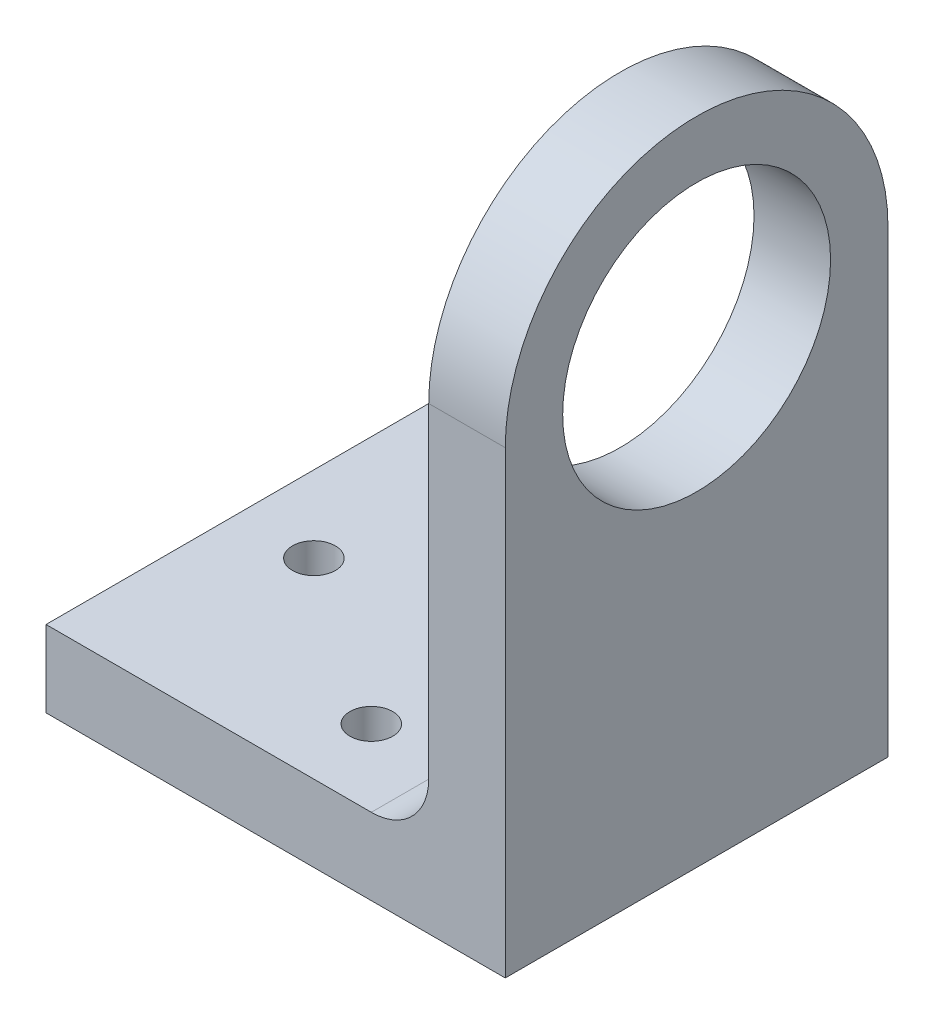
from build123d import *

# Parameters (mm, degrees)
SKETCH3_R           = 11.1125
BOSS_EXTRUDE1_DEPTH = 6.35
SKETCH5_W           = 31.75
SKETCH5_H           = 6.35
BOSS_EXTRUDE2_DEPTH = 38.1
FILLET1_R           = 4.7625
SKETCH6_R           = 1.777000002
CUT_EXTRUDE1_DEPTH  = 66.454301807


with BuildPart() as part:
    # Sketch3 → Boss-Extrude1 (new body)
    with BuildSketch(Plane(origin=(0, 0, 0), x_dir=(0, 0, -1), z_dir=(1, 0, 0))):
        with BuildLine():
            Line((0, 0), (31.75, 0))
            Line((31.75, 0), (31.75, 31.75))
            ThreePointArc((31.75, 31.75), (15.875, 47.625), (0, 31.75))
            Line((0, 31.75), (0, 0))
        make_face()
        with Locations((15.875, 31.75)):
            Circle(SKETCH3_R, mode=Mode.SUBTRACT)
    extrude(amount=BOSS_EXTRUDE1_DEPTH)

    # Sketch5 → Boss-Extrude2 (add)
    with BuildSketch(Plane(origin=(6.35, 0, 0), x_dir=(0, 0, -1), z_dir=(1, 0, 0))):
        with Locations((15.875, -3.175)):
            Rectangle(SKETCH5_W, SKETCH5_H)
    extrude(amount=-BOSS_EXTRUDE2_DEPTH)

    # Fillet1
    fillet1_edges = [part.edges().sort_by_distance(p)[0] for p in [
        (0, 0, -15.875),
    ]]
    fillet(fillet1_edges, radius=FILLET1_R)

    # Sketch6 → Cut-Extrude1 (cut, through all)
    with BuildSketch(Plane(origin=(0, 0, 0), x_dir=(1, 0, 0), z_dir=(0, 1, 0))):
        with Locations((-11.1125, 6.35)):
            Circle(SKETCH6_R)
        with Locations((-25.4, 15.875)):
            Circle(SKETCH6_R)
        with Locations((-11.1125, 25.4)):
            Circle(SKETCH6_R)
    extrude(amount=-CUT_EXTRUDE1_DEPTH, mode=Mode.SUBTRACT)


solid = part.part
